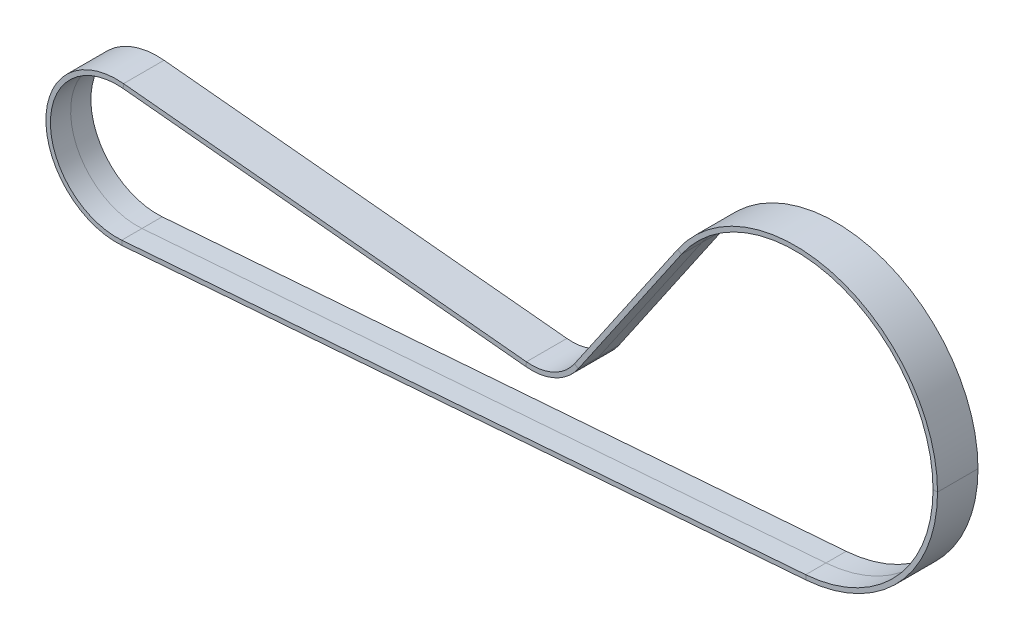
from build123d import *


with BuildPart() as part:
    # Sweep1: sweep along a path in Sketch2
    with BuildLine(Plane.XY) as sweep1_path:
        Line((4.069339119, -32.166085282), (-148.03091533, -43.797416737))
        ThreePointArc((-148.03091533, -43.797416737), (-165.621268829, -27.325260793), (-147.682759102, -11.232954356))
        Line((-147.682759102, -11.232954356), (-58.102020633, -20.013371873))
        ThreePointArc((-58.102020633, -20.013371873), (-52.380198578, -19.035229932), (-47.952965902, -15.280816515))
        Line((-47.952965902, -15.280816515), (-25.007917232, 18.226847922))
        ThreePointArc((-25.007917232, 18.226847922), (29.551639432, 16.122881063), (4.069339119, -32.166085282))
    # Sketch3 → Sweep1 (sweep)
    with BuildSketch(Plane(origin=(0, 0, 0), x_dir=(1, 0, 0), z_dir=(0, 1, 0))):
        Polygon((32.26, 0), (32.26, -4.5), (33.26, -4.5), (33.26, 4.5), (32.26, 4.5), align=None)
    sweep(path=sweep1_path.line)


solid = part.part
